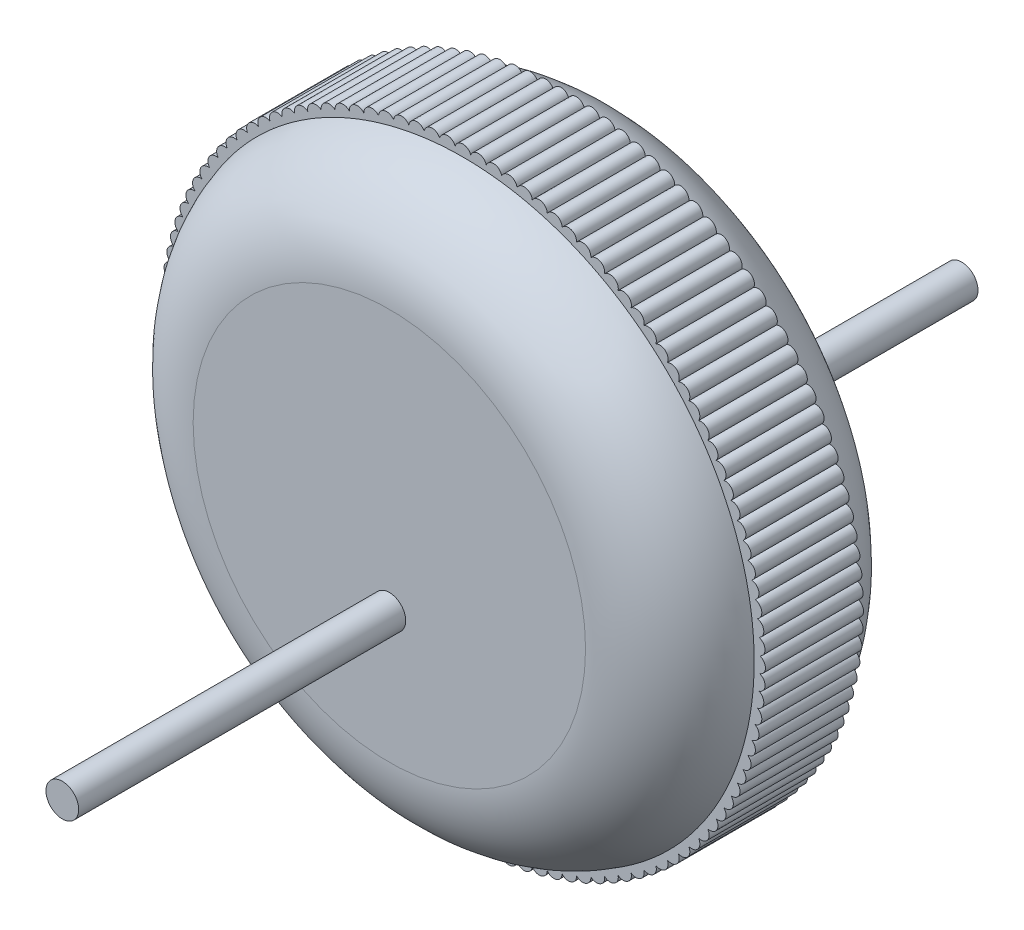
from build123d import *

# Parameters (mm, degrees)
SKETCH2_R           = 9
BOSS_EXTRUDE1_DEPTH = 3.75
FILLET1_R           = 3
SKETCH3_R           = 0.25
BOSS_EXTRUDE2_DEPTH = 1.5
CIRPATTERN1_COUNT   = 120
SKETCH4_R           = 0.5
BOSS_EXTRUDE3_DEPTH = 10
BOSS_EXTRUDE4_START = 10
SKETCH5_R           = 0.5
BOSS_EXTRUDE4_DEPTH = 10


with BuildPart() as part:
    # Sketch2 → Boss-Extrude1 (new, symmetric)
    with BuildSketch(Plane.XY):
        Circle(SKETCH2_R)
    extrude(amount=BOSS_EXTRUDE1_DEPTH, both=True)

    # Fillet1
    fillet1_edges = [part.edges().sort_by_distance(p)[0] for p in [
        (-9, 0, -3.75),
        (-9, 0, 3.75),
    ]]
    fillet(fillet1_edges, radius=FILLET1_R)

    # Sketch3 → Boss-Extrude2 (add, symmetric)
    with BuildSketch(Plane.XY):
        with Locations((0, 9)):
            Circle(SKETCH3_R)
    boss_extrude2 = extrude(amount=BOSS_EXTRUDE2_DEPTH, both=True)

    # CirPattern1: Boss-Extrude2 ×120 about axis
    cirpattern1_axis = Axis((0, 0, 0), (0, 0, 1))
    for i in range(1, CIRPATTERN1_COUNT):
        add(boss_extrude2.rotate(cirpattern1_axis, i * 360 / CIRPATTERN1_COUNT))

    # Sketch4 → Boss-Extrude3 (add)
    with BuildSketch(Plane.XY.offset(3.75)):
        with Locations((0, -2)):
            Circle(SKETCH4_R)
    extrude(amount=BOSS_EXTRUDE3_DEPTH)

    # Sketch5 → Boss-Extrude4 (add)
    with BuildSketch(Plane(origin=(0, 0, -3.75), x_dir=(-1, 0, 0), z_dir=(0, 0, -1)).offset(BOSS_EXTRUDE4_START)):
        with Locations(Location((0, -2, 0), (0, 0, 180))):
            Circle(SKETCH5_R)
    extrude(amount=-BOSS_EXTRUDE4_DEPTH)


solid = part.part
